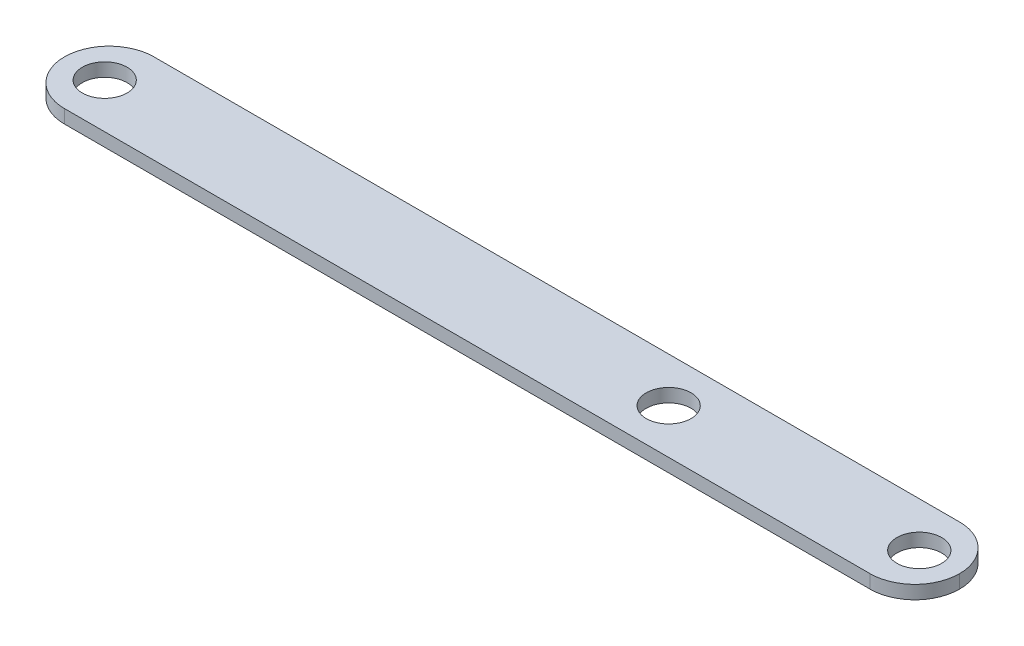
from build123d import *

# Parameters (mm, degrees)
SKETCH2_W           = 200
SKETCH2_H           = 20
BOSS_EXTRUDE1_DEPTH = 3
SKETCH3_R           = 5
CUT_EXTRUDE1_DEPTH  = 202.019899512
SKETCH4_R           = 5
CUT_EXTRUDE2_DEPTH  = 202.019899512
FILLET1_R           = 10
FILLET2_R           = 10
SKETCH5_R           = 5
CUT_EXTRUDE3_DEPTH  = 202.019899512


with BuildPart() as part:
    # Sketch2 → Boss-Extrude1 (new body)
    with BuildSketch(Plane(origin=(0, 0, 0), x_dir=(1, 0, 0), z_dir=(0, 1, 0))):
        with Locations((100, 10)):
            Rectangle(SKETCH2_W, SKETCH2_H)
    extrude(amount=BOSS_EXTRUDE1_DEPTH)

    # Sketch3 → Cut-Extrude1 (cut, through all)
    with BuildSketch(Plane(origin=(0, 3, 0), x_dir=(1, 0, 0), z_dir=(0, 1, 0))):
        with Locations(Location((9, 10, 0), (0, 0, 270))):
            Circle(SKETCH3_R)
    extrude(amount=-CUT_EXTRUDE1_DEPTH, mode=Mode.SUBTRACT)

    # Sketch4 → Cut-Extrude2 (cut, through all)
    with BuildSketch(Plane(origin=(0, 3, 0), x_dir=(1, 0, 0), z_dir=(0, 1, 0))):
        with Locations(Location((191, 10, 0), (0, 0, 270))):
            Circle(SKETCH4_R)
    extrude(amount=-CUT_EXTRUDE2_DEPTH, mode=Mode.SUBTRACT)

    # Fillet1
    fillet1_edges = [part.edges().sort_by_distance(p)[0] for p in [
        (0, 1.5, -20),
        (0, 1.5, 0),
    ]]
    fillet(fillet1_edges, radius=FILLET1_R - 0.0001)  # a hair under: the kernel refuses the full size

    # Fillet2
    fillet2_edges = [part.edges().sort_by_distance(p)[0] for p in [
        (200, 1.5, -20),
        (200, 1.5, 0),
    ]]
    fillet(fillet2_edges, radius=FILLET2_R - 0.0001)  # a hair under: the kernel refuses the full size

    # Sketch5 → Cut-Extrude3 (cut, through all)
    with BuildSketch(Plane(origin=(0, 3, 0), x_dir=(1, 0, 0), z_dir=(0, 1, 0))):
        with Locations(Location((135, 10, 0), (0, 0, 270))):
            Circle(SKETCH5_R)
    extrude(amount=-CUT_EXTRUDE3_DEPTH, mode=Mode.SUBTRACT)


solid = part.part
